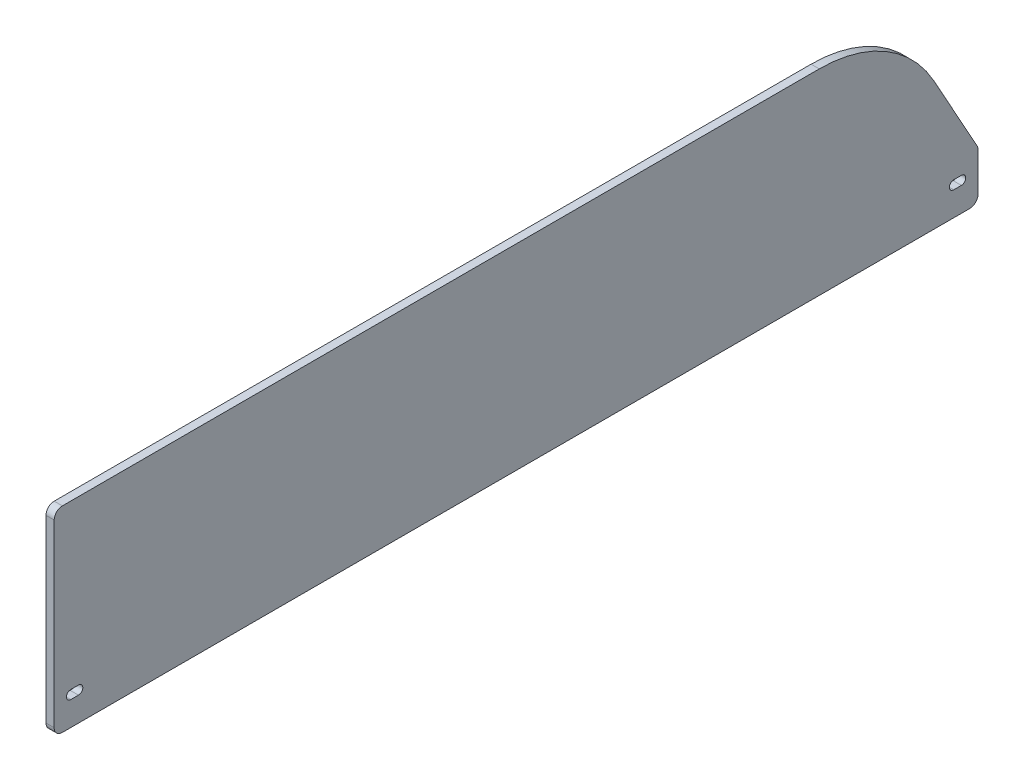
from build123d import *

# Parameters (mm, degrees)
BOSS_EXTRUDE1_DEPTH         = 6.35
FILLET1_R                   = 101.6
F_1_4_CLEARANCE_SLOT1_DEPTH = 6.35
FILLET2_R                   = 6.35


# Read off the part's stored shape, not the designer's step: 1/4 Clearance Slot1
with BuildPart() as part:
    # Sketch1 → Boss-Extrude1 (new body)
    with BuildSketch(Plane(origin=(0, 0, 0), x_dir=(0, 0, -1), z_dir=(1, 0, 0))):
        Polygon((0, 0), (0, 152.4), (654.05, 152.4), (717.55, 38.1), (717.55, 0), align=None)
    extrude(amount=BOSS_EXTRUDE1_DEPTH)

    # Fillet1
    fillet1_edges = [part.edges().sort_by_distance(p)[0] for p in [
        (3.175, 152.4, -654.05),
    ]]
    fillet(fillet1_edges, radius=FILLET1_R)

    # 1/4 Clearance Slot1 outline → 1/4 Clearance Slot1 (cut)
    with BuildSketch(Plane.YZ):
        with BuildLine():
            ThreePointArc((25.6032, -698.7032), (22.225, -695.325), (18.8468, -698.7032))
            Line((18.8468, -698.7032), (18.8468, -704.6468))
            ThreePointArc((18.8468, -704.6468), (22.225, -708.025), (25.6032, -704.6468))
            Line((25.6032, -704.6468), (25.6032, -698.7032))
        make_face()
        with BuildLine():
            Line((25.6032, -18.8468), (25.6032, -12.9032))
            ThreePointArc((25.6032, -12.9032), (22.225, -9.525), (18.8468, -12.9032))
            Line((18.8468, -12.9032), (18.8468, -18.8468))
            ThreePointArc((18.8468, -18.8468), (22.225, -22.225), (25.6032, -18.8468))
        make_face()
    extrude(amount=F_1_4_CLEARANCE_SLOT1_DEPTH, mode=Mode.SUBTRACT)

    # Fillet2
    fillet2_edges = [part.edges().sort_by_distance(p)[0] for p in [
        (3.175, 0, 0),
        (3.175, 152.4, 0),
        (3.175, 38.1, -717.55),
        (3.175, 0, -717.55),
    ]]
    fillet(fillet2_edges, radius=FILLET2_R)


solid = part.part
